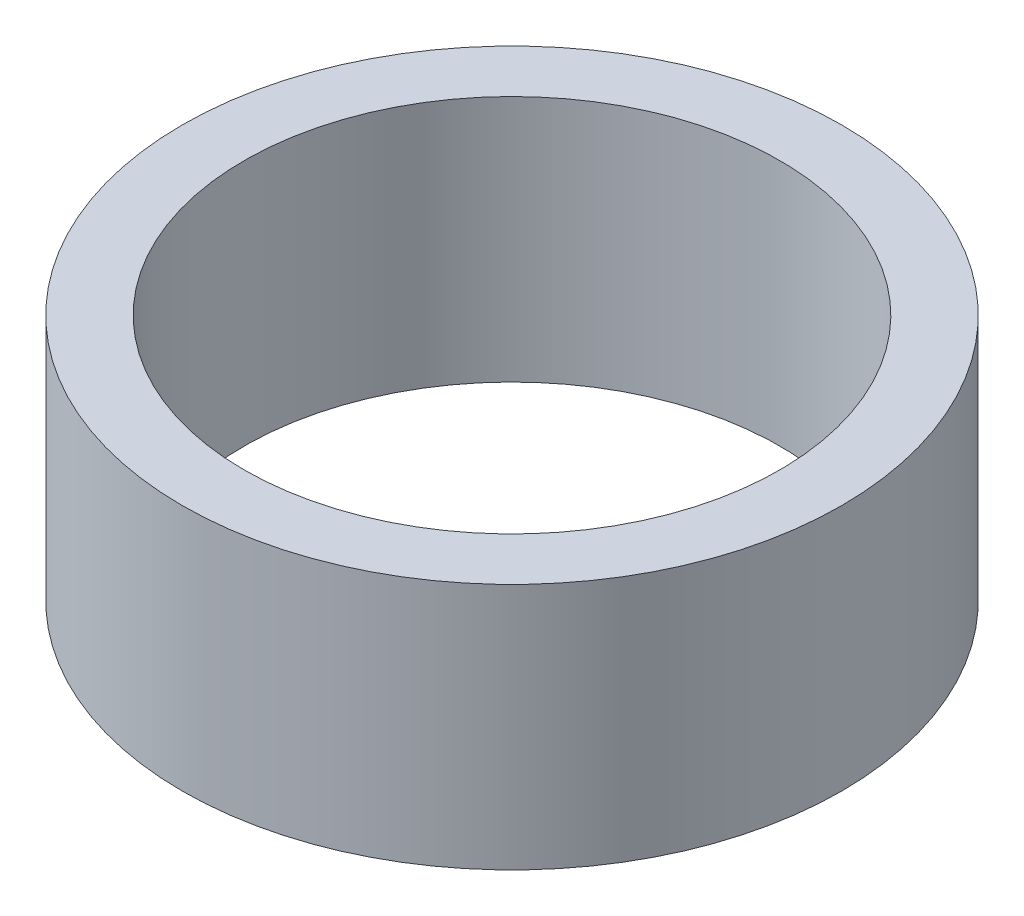
from build123d import *

# Parameters (mm, degrees)
SKETCH1_R           = 40
BOSS_EXTRUDE1_DEPTH = 30
SKETCH2_R           = 32.5
CUT_EXTRUDE1_DEPTH  = 65.031242374


with BuildPart() as part:
    # Sketch1 → Boss-Extrude1 (new body)
    with BuildSketch(Plane(origin=(0, 0, 0), x_dir=(1, 0, 0), z_dir=(0, 1, 0))):
        Circle(SKETCH1_R)
    extrude(amount=BOSS_EXTRUDE1_DEPTH)

    # Sketch2 → Cut-Extrude1 (cut, through all)
    with BuildSketch(Plane(origin=(0, 0, 0), x_dir=(1, 0, 0), z_dir=(0, 1, 0))):
        Circle(SKETCH2_R)
    extrude(amount=CUT_EXTRUDE1_DEPTH, mode=Mode.SUBTRACT)


solid = part.part
